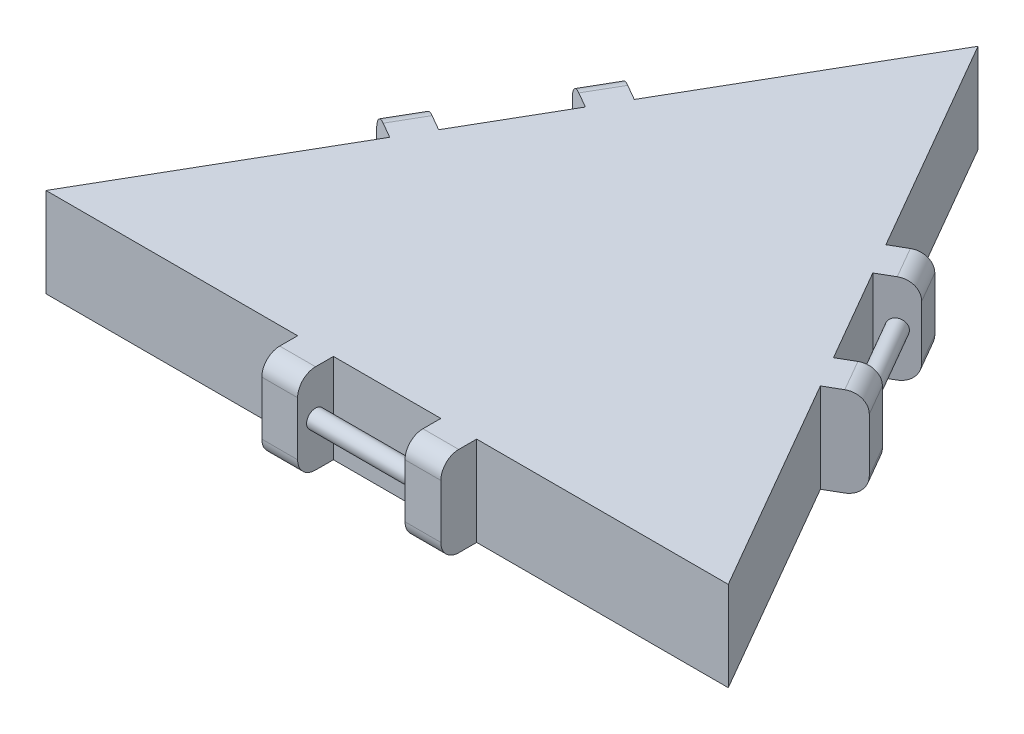
from build123d import *

# Parameters (mm, degrees)
BOSS_EXTRUDE1_DEPTH   = 50
BOSS_EXTRUDE2_DEPTH   = 50
BOSS_EXTRUDE2_2_DEPTH = 50
SKETCH3_W             = 100
SKETCH3_H             = 20
BOSS_EXTRUDE2_3_DEPTH = 50
SKETCH4_W             = 60
SKETCH4_H             = 20
CUT_EXTRUDE1_DEPTH    = 50
FILLET1_R             = 10
FILLET2_R             = 10
FILLET3_R             = 10
FILLET4_R             = 10
FILLET5_R             = 10
FILLET6_R             = 10
FILLET7_R             = 10
SKETCH5_R             = 5
BOSS_EXTRUDE3_DEPTH   = 80
SKETCH6_R             = 5
BOSS_EXTRUDE4_DEPTH   = 80


with BuildPart() as part:
    # Sketch1 → Boss-Extrude1 (new body)
    with BuildSketch(Plane(origin=(0, 0, 0), x_dir=(1, 0, 0), z_dir=(0, 1, 0))):
        Polygon((-190.55, -110), (190.55, -110), (0, 220.042281382), align=None)
    extrude(amount=BOSS_EXTRUDE1_DEPTH)


with BuildPart() as body_2:
    # Sketch3 → Boss-Extrude2 (new body)
    with BuildSketch(Plane(origin=(0, 0, 0), x_dir=(1, 0, 0), z_dir=(0, 1, 0))):
        Polygon((-128.935254038, 16.719870502), (-111.614745962, 6.719870502), (-61.614745962, 93.32241088), (-78.935254038, 103.32241088), align=None)
    extrude(amount=BOSS_EXTRUDE2_DEPTH)


with BuildPart() as body_3:
    # Sketch3 → Boss-Extrude2 2 (new body)
    with BuildSketch(Plane(origin=(0, 0, 0), x_dir=(1, 0, 0), z_dir=(0, 1, 0))):
        Polygon((111.614745962, 6.719870502), (61.614745962, 93.32241088), (78.935254038, 103.32241088), (128.935254038, 16.719870502), align=None)
    extrude(amount=BOSS_EXTRUDE2_2_DEPTH)


with BuildPart() as body_4:
    # Sketch3 → Boss-Extrude2 3 (new body)
    with BuildSketch(Plane(origin=(0, 0, 0), x_dir=(1, 0, 0), z_dir=(0, 1, 0))):
        with Locations((0, -110)):
            Rectangle(SKETCH3_W, SKETCH3_H)
    extrude(amount=BOSS_EXTRUDE2_3_DEPTH)


with BuildPart() as body_2_1:
    # Body-Move/Copy1: read off the stored shape, not the designer's step
    # Body-Move/Copy1: moved
    add(body_2.part.moved(Location((-8.660254, 0, -5))))


with BuildPart() as body_3_1:
    # Body-Move/Copy2: read off the stored shape, not the designer's step
    # Body-Move/Copy2: moved
    add(body_3.part.moved(Location((8.660254, 0, -5))))


with BuildPart() as body_4_1:
    # Body-Move/Copy3: read off the stored shape, not the designer's step
    # Body-Move/Copy3: moved
    add(body_4.part.moved(Location((0, 0, 10))))


with BuildPart() as cut_extrude1_tool:
    # Sketch4 → Cut-Extrude1 (new body)
    with BuildSketch(Plane(origin=(0, 50, 0), x_dir=(1, 0, 0), z_dir=(0, 1, 0))):
        Polygon((-97.595508076, 91.001902805), (-80.275, 81.001902805), (-110.275, 29.040378578), (-127.595508076, 39.040378578), align=None)
        Polygon((127.595508076, 39.040378578), (97.595508076, 91.001902805), (80.275, 81.001902805), (110.275, 29.040378578), align=None)
        with Locations((0, -120)):
            Rectangle(SKETCH4_W, SKETCH4_H)
    extrude(amount=-CUT_EXTRUDE1_DEPTH)


with BuildPart() as body_2_2:
    add(body_2_1.part)

    # Cut-Extrude1: cut by cut_extrude1_tool
    add(cut_extrude1_tool.part, mode=Mode.SUBTRACT)


with BuildPart() as body_3_2:
    add(body_3_1.part)

    # Cut-Extrude1: cut by cut_extrude1_tool
    add(cut_extrude1_tool.part, mode=Mode.SUBTRACT)


with BuildPart() as body_4_2:
    add(body_4_1.part)

    # Cut-Extrude1: cut by cut_extrude1_tool
    add(cut_extrude1_tool.part, mode=Mode.SUBTRACT)


with BuildPart() as cut_extrude1_piece_1:
    # of the separate pieces the step leaves, piece 1, a body of its own (cut_extrude1_pieces)
    add(body_2_2.part.solids().sort_by_distance((-87.595508038, 0, -108.32241088))[0])

    # Fillet1
    fillet1_edges = [cut_extrude1_piece_1.edges().sort_by_distance(p)[0] for p in [
        (-92.595508043, 0, -99.662156834),
        (-92.595508043, 50, -99.662156834),
    ]]
    fillet(fillet1_edges, radius=FILLET1_R)


with BuildPart() as cut_extrude1_piece_2:
    # of the separate pieces the step leaves, piece 2, a body of its own (cut_extrude1_pieces)
    add(body_2_2.part.solids().sort_by_distance((-137.595508038, 0, -21.719870502))[0])

    # Fillet2
    fillet2_edges = [cut_extrude1_piece_2.edges().sort_by_distance(p)[0] for p in [
        (-132.595508043, 0, -30.380124532),
        (-132.595508043, 50, -30.380124532),
    ]]
    fillet(fillet2_edges, radius=FILLET2_R)


with BuildPart() as cut_extrude1_piece_1_of_body_3:
    # of the separate pieces the step leaves, piece 1, a body of its own (cut_extrude1_pieces_of_body_3)
    add(body_3_2.part.solids().sort_by_distance((80.275, 0, -81.001902805))[0])

    # Fillet7
    fillet7_edges = [cut_extrude1_piece_1_of_body_3.edges().sort_by_distance(p)[0] for p in [
        (92.595508043, 0, -99.662156834),
        (92.595508043, 50, -99.662156834),
    ]]
    fillet(fillet7_edges, radius=FILLET7_R)


with BuildPart() as cut_extrude1_piece_2_of_body_3:
    # of the separate pieces the step leaves, piece 2, a body of its own (cut_extrude1_pieces_of_body_3)
    add(body_3_2.part.solids().sort_by_distance((120.274999962, 0, -11.719870502))[0])

    # Fillet6
    fillet6_edges = [cut_extrude1_piece_2_of_body_3.edges().sort_by_distance(p)[0] for p in [
        (132.595508043, 0, -30.380124532),
        (132.595508043, 50, -30.380124532),
    ]]
    fillet(fillet6_edges, radius=FILLET6_R)


with BuildPart() as cut_extrude1_piece_1_of_body_4:
    # of the separate pieces the step leaves, piece 1, a body of its own (cut_extrude1_pieces_of_body_4)
    add(body_4_2.part.solids().sort_by_distance((50, 0, 110))[0])

    # Fillet5
    fillet5_edges = [cut_extrude1_piece_1_of_body_4.edges().sort_by_distance(p)[0] for p in [
        (40, 0, 130),
        (40, 50, 130),
    ]]
    fillet(fillet5_edges, radius=FILLET5_R)


with BuildPart() as cut_extrude1_piece_2_of_body_4:
    # of the separate pieces the step leaves, piece 2, a body of its own (cut_extrude1_pieces_of_body_4)
    add(body_4_2.part.solids().sort_by_distance((-30, 0, 110))[0])

    # Fillet3
    fillet3_edges = [cut_extrude1_piece_2_of_body_4.edges().sort_by_distance(p)[0] for p in [
        (-40, 50, 130),
    ]]
    fillet(fillet3_edges, radius=FILLET3_R)

    # Fillet4
    fillet4_edges = [cut_extrude1_piece_2_of_body_4.edges().sort_by_distance(p)[0] for p in [
        (-40, 0, 130),
    ]]
    fillet(fillet4_edges, radius=FILLET4_R)


with BuildPart() as cut_extrude1_piece_2_of_body_3_1:
    add(cut_extrude1_piece_2_of_body_3.part)

    # Combine1: union Cut-Extrude1 piece 2, Cut-Extrude1 piece 2 of body 4, part, Cut-Extrude1 piece 1 of body 4, Cut-Extrude1 piece 1, Cut-Extrude1 piece 1 of body 3
    add(cut_extrude1_piece_2.part)
    add(cut_extrude1_piece_2_of_body_4.part)
    add(part.part)
    add(cut_extrude1_piece_1_of_body_4.part)
    add(cut_extrude1_piece_1.part)
    add(cut_extrude1_piece_1_of_body_3.part)


with BuildPart() as body_2_2_1:
    # Sketch5 → Boss-Extrude3 (new body)
    with BuildSketch(Plane(origin=(-24.993897208, 0, 43.290699844), x_dir=(0.8660254037844362, 0, 0.5000000000000046), z_dir=(-0.5000000000000044, 0, 0.866025403784436))):
        with Locations((-120.021140691, 25)):
            Circle(SKETCH5_R)
    extrude(amount=-BOSS_EXTRUDE3_DEPTH)


with BuildPart() as body_3_2_1:
    # Mirror3: mirrored copy
    add(body_2_2_1.part.mirror(Plane(origin=(0, 0, 0), x_dir=(0, 0, 1), z_dir=(1, 0, 0))))


with BuildPart() as body_2_2_2:
    add(body_2_2_1.part)

    # Combine2: union body 3 2, Cut-Extrude1 piece 2 of body 3
    add(body_3_2_1.part)
    add(cut_extrude1_piece_2_of_body_3_1.part)

    # Sketch6 → Boss-Extrude4 (add)
    with BuildSketch(Plane.ZY.offset(50)):
        with Locations((120, 25)):
            Circle(SKETCH6_R)
    extrude(amount=-BOSS_EXTRUDE4_DEPTH)


solid = body_2_2_2.part
